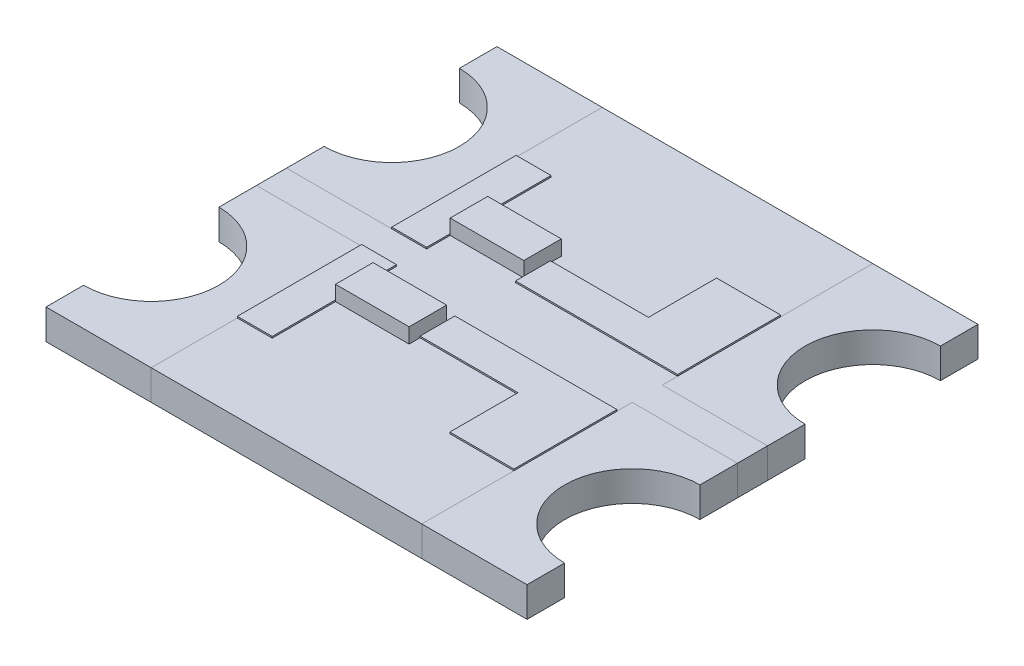
from build123d import *

# Parameters (mm, degrees)
EXTRUDE_1_DEPTH   = 0.1
EXTRUDE_1_2_DEPTH = 0.1
EXTRUDE_1_3_DEPTH = 0.1
EXTRUDE_1_4_DEPTH = 0.1
EXTRUDE_2_DEPTH   = 0.1
SKETCH_3_W        = 0.244847071
SKETCH_3_H        = 0.124823996
EXTRUDE_3_DEPTH   = 0.05
EXTRUDE_3_2_DEPTH = 0.05
EXTRUDE_4_DEPTH   = 0.005
EXTRUDE_4_2_DEPTH = 0.005
EXTRUDE_4_3_DEPTH = 0.005
EXTRUDE_4_4_DEPTH = 0.005


with BuildPart() as part:
    # 草图1 → 凸台-拉伸1 (new body)
    with BuildSketch(Plane(origin=(0, 0, 0), x_dir=(1, 0, 0), z_dir=(0, 1, 0))):
        with BuildLine():
            Line((-0.8, 0.625), (-0.8, 0.75))
            Line((-0.8, 0.75), (-0.45, 0.75))
            Line((-0.45, 0.75), (-0.45, 0.4))
            Line((-0.45, 0.4), (-0.45, 0.05))
            Line((-0.45, 0.05), (-0.8, 0.05))
            Line((-0.8, 0.05), (-0.8, 0.175))
            ThreePointArc((-0.8, 0.175), (-0.575, 0.4), (-0.8, 0.625))
        make_face()
    extrude(amount=EXTRUDE_1_DEPTH)


with BuildPart() as body_2:
    # 草图1 → Extrude 1 2 (new body)
    with BuildSketch(Plane(origin=(0, 0, 0), x_dir=(1, 0, 0), z_dir=(0, 1, 0))):
        with BuildLine():
            Line((0.45, 0.05), (0.45, 0.4))
            Line((0.45, 0.4), (0.45, 0.75))
            Line((0.45, 0.75), (0.8, 0.75))
            Line((0.8, 0.75), (0.8, 0.625))
            ThreePointArc((0.8, 0.625), (0.575, 0.4), (0.8, 0.175))
            Line((0.8, 0.175), (0.8, 0.05))
            Line((0.8, 0.05), (0.45, 0.05))
        make_face()
    extrude(amount=EXTRUDE_1_2_DEPTH)


with BuildPart() as body_3:
    # 草图1 → Extrude 1 3 (new body)
    with BuildSketch(Plane(origin=(0, 0, 0), x_dir=(1, 0, 0), z_dir=(0, 1, 0))):
        with BuildLine():
            Line((0.8, -0.175), (0.8, -0.05))
            Line((0.8, -0.05), (0.45, -0.05))
            Line((0.45, -0.05), (0.45, -0.4))
            Line((0.45, -0.4), (0.45, -0.75))
            Line((0.45, -0.75), (0.8, -0.75))
            Line((0.8, -0.75), (0.8, -0.625))
            ThreePointArc((0.8, -0.625), (0.575, -0.4), (0.8, -0.175))
        make_face()
    extrude(amount=EXTRUDE_1_3_DEPTH)


with BuildPart() as body_4:
    # 草图1 → Extrude 1 4 (new body)
    with BuildSketch(Plane(origin=(0, 0, 0), x_dir=(1, 0, 0), z_dir=(0, 1, 0))):
        with BuildLine():
            Line((-0.45, -0.05), (-0.45, -0.4))
            Line((-0.45, -0.4), (-0.45, -0.75))
            Line((-0.45, -0.75), (-0.8, -0.75))
            Line((-0.8, -0.75), (-0.8, -0.625))
            ThreePointArc((-0.8, -0.625), (-0.575, -0.4), (-0.8, -0.175))
            Line((-0.8, -0.175), (-0.8, -0.05))
            Line((-0.8, -0.05), (-0.45, -0.05))
        make_face()
    extrude(amount=EXTRUDE_1_4_DEPTH)


with BuildPart() as body_5:
    # 草图2 → 凸台-拉伸2 (new body)
    with BuildSketch(Plane(origin=(0, 0, 0), x_dir=(1, 0, 0), z_dir=(0, 1, 0))):
        Polygon((-0.8, 0.05), (-0.8, -0.05), (-0.45, -0.05), (-0.45, -0.75), (0.45, -0.75), (0.45, -0.05), (0.8, -0.05), (0.8, 0.05), (0.45, 0.05), (0.45, 0.75), (-0.45, 0.75), (-0.45, 0.05), align=None)
    extrude(amount=EXTRUDE_2_DEPTH)


with BuildPart() as body_6:
    # 草图3 → 凸台-拉伸3 (new body)
    with BuildSketch(Plane(origin=(0, 0.1, 0), x_dir=(1, 0, 0), z_dir=(0, 1, 0))):
        with Locations((-0.211552672, -0.190733485)):
            Rectangle(SKETCH_3_W, SKETCH_3_H)
    extrude(amount=EXTRUDE_3_DEPTH)


with BuildPart() as body_7:
    # 草图3 → Extrude 3 2 (new body)
    with BuildSketch(Plane(origin=(0, 0.1, 0), x_dir=(1, 0, 0), z_dir=(0, 1, 0))):
        with Locations((-0.211552672, 0.190733485)):
            Rectangle(SKETCH_3_W, SKETCH_3_H)
    extrude(amount=EXTRUDE_3_2_DEPTH)


with BuildPart() as body_8:
    # 草图4 → 凸台-拉伸4 (new body)
    with BuildSketch(Plane(origin=(0, 0.1, 0), x_dir=(1, 0, 0), z_dir=(0, 1, 0))):
        Polygon((-0.45, 0.463660652), (-0.333859494, 0.463660652), (-0.333976207, 0.253145483), (-0.333976207, 0.05), (-0.45, 0.05), align=None)
    extrude(amount=EXTRUDE_4_DEPTH)


with BuildPart() as body_9:
    # 草图4 → Extrude 4 2 (new body)
    with BuildSketch(Plane(origin=(0, 0.1, 0), x_dir=(1, 0, 0), z_dir=(0, 1, 0))):
        Polygon((-0.089129136, 0.216946556), (0.236916902, 0.216946556), (0.236916902, 0.443656807), (0.45, 0.443656807), (0.45, 0.100924251), (-0.089129136, 0.100924251), align=None)
    extrude(amount=EXTRUDE_4_2_DEPTH)


with BuildPart() as body_10:
    # 草图4 → Extrude 4 3 (new body)
    with BuildSketch(Plane(origin=(0, 0.1, 0), x_dir=(1, 0, 0), z_dir=(0, 1, 0))):
        Polygon((0.45, -0.100924251), (-0.089129136, -0.100924251), (-0.089129136, -0.216946556), (0.236916902, -0.216946556), (0.236916902, -0.443656807), (0.45, -0.443656807), align=None)
    extrude(amount=EXTRUDE_4_3_DEPTH)


with BuildPart() as body_11:
    # 草图4 → Extrude 4 4 (new body)
    with BuildSketch(Plane(origin=(0, 0.1, 0), x_dir=(1, 0, 0), z_dir=(0, 1, 0))):
        Polygon((-0.333976207, -0.05), (-0.45, -0.05), (-0.45, -0.463660652), (-0.333859494, -0.463660652), (-0.333976207, -0.253145483), align=None)
    extrude(amount=EXTRUDE_4_4_DEPTH)


solid = Compound([part.part, body_2.part, body_3.part, body_4.part, body_5.part, body_6.part, body_7.part, body_8.part, body_9.part, body_10.part, body_11.part])
